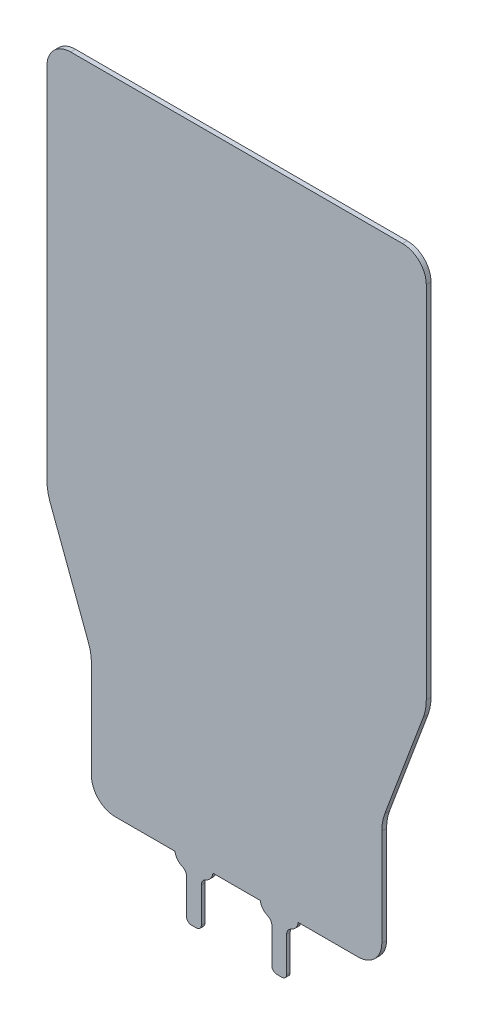
from build123d import *

# Parameters (mm, degrees)
BOSS_EXTRUDE1_DEPTH = 0.2
SKETCH3_R           = 5
BOSS_EXTRUDE2_DEPTH = 0.2
SKETCH4_R           = 5
CUT_EXTRUDE1_DEPTH  = 0.05
FILLET1_R           = 0.5
FILLET2_R           = 0.2


with BuildPart() as part:
    # Sketch2 → Boss-Extrude1 (new body)
    with BuildSketch(Plane.XY):
        with BuildLine():
            Line((-5.123848106, -13.5), (5.123848106, -13.5))
            ThreePointArc((5.123848106, -13.5), (5.830954887, -13.207106781), (6.123848106, -12.5))
            Line((6.123848106, -12.5), (6.123848106, -8.39885311))
            ThreePointArc((6.123848106, -8.39885311), (6.155941006, -8.042003499), (6.251189751, -7.696606227))
            Line((6.251189751, -7.696606227), (7.872658355, -3.372689949))
            ThreePointArc((7.872658355, -3.372689949), (7.9679071, -3.027292676), (8, -2.670443065))
            Line((8, -2.670443065), (8, 12.5))
            ThreePointArc((8, 12.5), (7.707106781, 13.207106781), (7, 13.5))
            Line((7, 13.5), (-7, 13.5))
            ThreePointArc((-7, 13.5), (-7.707106781, 13.207106781), (-8, 12.5))
            Line((-8, 12.5), (-8, -2.670443065))
            ThreePointArc((-8, -2.670443065), (-7.9679071, -3.027292676), (-7.872658355, -3.372689949))
            Line((-7.872658355, -3.372689949), (-6.251189751, -7.696606227))
            ThreePointArc((-6.251189751, -7.696606227), (-6.155941006, -8.042003499), (-6.123848106, -8.39885311))
            Line((-6.123848106, -8.39885311), (-6.123848106, -12.5))
            ThreePointArc((-6.123848106, -12.5), (-5.830954887, -13.207106781), (-5.123848106, -13.5))
        make_face()
    extrude(amount=BOSS_EXTRUDE1_DEPTH)

    # Sketch3 → Boss-Extrude2 (add)
    with BuildSketch(Plane(origin=(0, 0, 0), x_dir=(-1, 0, 0), z_dir=(0, 0, -1))):
        with BuildLine():
            Line((1, 0.098294397), (1, -13.875268119))
            Line((1, -13.875268119), (1.189324579, -13.875268119))
            ThreePointArc((1.189324579, -13.875268119), (1.401456614, -13.963136085), (1.489324579, -14.175268119))
            Line((1.489324579, -14.175268119), (1.489324579, -15.850374766))
            Line((1.489324579, -15.850374766), (2.110675421, -15.850374766))
            Line((2.110675421, -15.850374766), (2.110675421, -14.175268119))
            ThreePointArc((2.110675421, -14.175268119), (2.198543386, -13.963136085), (2.410675421, -13.875268119))
            Line((2.410675421, -13.875268119), (2.6, -13.875268119))
            Line((2.6, -13.875268119), (2.6, 0.588618902))
            ThreePointArc((2.6, 0.588618902), (0, 12.417117813), (-2.6, 0.588618902))
            Line((-2.6, 0.588618902), (-2.6, -13.875268119))
            Line((-2.6, -13.875268119), (-2.410675421, -13.875268119))
            ThreePointArc((-2.410675421, -13.875268119), (-2.198543386, -13.963136085), (-2.110675421, -14.175268119))
            Line((-2.110675421, -14.175268119), (-2.110675421, -15.850374766))
            Line((-2.110675421, -15.850374766), (-1.489324579, -15.850374766))
            Line((-1.489324579, -15.850374766), (-1.489324579, -14.175268119))
            ThreePointArc((-1.489324579, -14.175268119), (-1.401456614, -13.963136085), (-1.189324579, -13.875268119))
            Line((-1.189324579, -13.875268119), (-1, -13.875268119))
            Line((-1, -13.875268119), (-1, 0.098294397))
            ThreePointArc((-1, 0.098294397), (0, 0.017117813), (1, 0.098294397))
        make_face()
        with Locations((0, 6.217117813)):
            Circle(SKETCH3_R, mode=Mode.SUBTRACT)
    extrude(amount=-BOSS_EXTRUDE2_DEPTH)

    # Sketch4 → Cut-Extrude1 (cut)
    with BuildSketch(Plane(origin=(0, 0, 0), x_dir=(-1, 0, 0), z_dir=(0, 0, -1))):
        with BuildLine():
            Line((1, -13.875268119), (1.189324579, -13.875268119))
            ThreePointArc((1.189324579, -13.875268119), (1.401456614, -13.963136085), (1.489324579, -14.175268119))
            Line((1.489324579, -14.175268119), (1.489324579, -15.850374766))
            Line((1.489324579, -15.850374766), (2.110675421, -15.850374766))
            Line((2.110675421, -15.850374766), (2.110675421, -14.175268119))
            ThreePointArc((2.110675421, -14.175268119), (2.198543386, -13.963136085), (2.410675421, -13.875268119))
            Line((2.410675421, -13.875268119), (2.6, -13.875268119))
            Line((2.6, -13.875268119), (2.6, 0.588618902))
            ThreePointArc((2.6, 0.588618902), (0, 12.417117813), (-2.6, 0.588618902))
            Line((-2.6, 0.588618902), (-2.6, -13.875268119))
            Line((-2.6, -13.875268119), (-2.410675421, -13.875268119))
            ThreePointArc((-2.410675421, -13.875268119), (-2.198543386, -13.963136085), (-2.110675421, -14.175268119))
            Line((-2.110675421, -14.175268119), (-2.110675421, -15.850374766))
            Line((-2.110675421, -15.850374766), (-1.489324579, -15.850374766))
            Line((-1.489324579, -15.850374766), (-1.489324579, -14.175268119))
            ThreePointArc((-1.489324579, -14.175268119), (-1.401456614, -13.963136085), (-1.189324579, -13.875268119))
            Line((-1.189324579, -13.875268119), (-1, -13.875268119))
            Line((-1, -13.875268119), (-1, 0.098294397))
            ThreePointArc((-1, 0.098294397), (0, 0.017117813), (1, 0.098294397))
            Line((1, 0.098294397), (1, -13.875268119))
        make_face()
        with Locations((0, 6.217117813)):
            Circle(SKETCH4_R, mode=Mode.SUBTRACT)
    extrude(amount=-CUT_EXTRUDE1_DEPTH, mode=Mode.SUBTRACT)

    # Fillet1
    # the kernel refuses this fillet: 0.5 mm, written as the material it takes off along each edge
    with BuildSketch(Plane(origin=(-2.6, -13.875268119, -0.888170298), x_dir=(0, 1, 0), z_dir=(0, 0, 1)), Plane(origin=(1, -13.875268119, -0.888170298), x_dir=(0, 1, 0), z_dir=(0, 0, 1))) as fillet1_piece_1:
        with BuildLine():
            CenterArc((0.438912275, -0.49593288), FILLET1_R, 97.312922169, 60.15129319)
            Line((-0.022907897, -0.304302692), (-0.069089914, -0.285139673))
            ThreePointArc((-0.069089914, -0.285139673), (-0.05, -0.189324579), (-0.05, 0))
            Line((-0.05, 0), (0, 0.05))
            ThreePointArc((0, 0.05), (0.18763406, 0.05), (0.368903703, 0.049593288))
            Line((0.368903703, 0.049593288), (0.375268119, 0))
        make_face()
    extrude(amount=2.026340595, mode=Mode.SUBTRACT)
    with BuildSketch(Plane(origin=(-1, -13.875268119, -0.888170298), x_dir=(-0.997178450014068, -0.07506756175300172, 0), z_dir=(0, 0, 1)), Plane(origin=(2.6, -13.875268119, -0.888170298), x_dir=(-0.997178450014068, -0.07506756175300161, 0), z_dir=(0, 0, 1))) as fillet1_piece_2:
        with BuildLine():
            CenterArc((0.461585506, -0.474902334), FILLET1_R, 108.23068039, 60.15129319)
            Line((-0.028170463, -0.374209281), (-0.07714606, -0.364139976))
            ThreePointArc((-0.07714606, -0.364139976), (-0.063944154, -0.183351263), (-0.049858923, 0.003753378))
            Line((-0.049858923, 0.003753378), (0.003753378, 0.049858923))
            ThreePointArc((0.003753378, 0.049858923), (0.192543769, 0.035646788), (0.289521549, 0.047490233))
            Line((0.289521549, 0.047490233), (0.305163727, 0))
        make_face()
    extrude(amount=2.026340595, mode=Mode.SUBTRACT)

    # Fillet2
    fillet2_edges = [part.edges().sort_by_distance(p)[0] for p in [
        (-2.110675421, -15.850374766, 0.125),
        (-1.489324579, -15.850374766, 0.125),
        (1.489324579, -15.850374766, 0.125),
        (2.110675421, -15.850374766, 0.125),
    ]]
    fillet(fillet2_edges, radius=FILLET2_R)


solid = part.part
